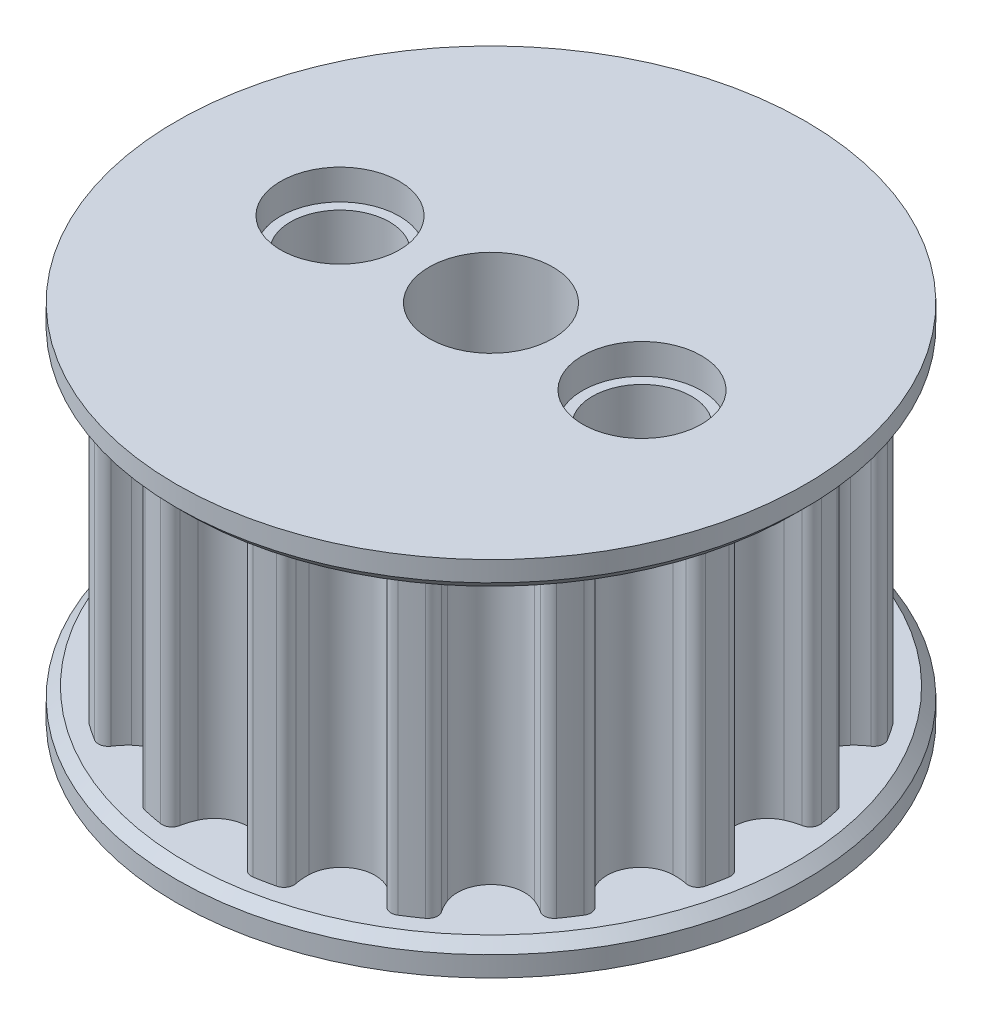
from build123d import *

# Parameters (mm, degrees)
SKETCH1_R           = 1.5625
BOSS_EXTRUDE1_DEPTH = 3.81
SKETCH2_R           = 7.9375
SKETCH2_R_2         = 1.5625
BOSS_EXTRUDE2_DEPTH = 0.762
SKETCH3_R           = 1.5
CUT_EXTRUDE1_DEPTH  = 15.009487375
SKETCH4_R           = 1.25
CUT_EXTRUDE2_DEPTH  = 14.567321493
CHAMFER1_SIZE       = 0.254


with BuildPart() as part:
    # Sketch1 → Boss-Extrude1 (new, symmetric)
    with BuildSketch(Plane(origin=(0, 0, 0), x_dir=(1, 0, 0), z_dir=(0, 1, 0))):
        with BuildLine():
            ThreePointArc((-1.850768, -6.777037356), (-1.816941892, -6.962421006), (-1.663291889, -7.071521784))
            ThreePointArc((-1.663291889, -7.071521784), (-1.417233644, -7.124914669), (-1.169472895, -7.169748489))
            ThreePointArc((-1.169472895, -7.169748489), (-0.985767742, -7.127751824), (-0.883573242, -6.969424355))
            ThreePointArc((-0.883573242, -6.969424355), (-0.839120956, -6.792881518), (-0.773880597, -6.622919538))
            ThreePointArc((-0.773880597, -6.622919538), (0, -6.1245), (0.773880597, -6.622919538))
            ThreePointArc((0.773880597, -6.622919538), (0.839120956, -6.792881518), (0.883573242, -6.969424355))
            ThreePointArc((0.883573242, -6.969424355), (0.985767742, -7.127751824), (1.169472895, -7.169748489))
            ThreePointArc((1.169472895, -7.169748489), (1.417233644, -7.124914669), (1.663291889, -7.071521784))
            ThreePointArc((1.663291889, -7.071521784), (1.816941892, -6.962421006), (1.850768, -6.777037356))
            ThreePointArc((1.850768, -6.777037356), (1.824276538, -6.596921889), (1.819509137, -6.414931089))
            ThreePointArc((1.819509137, -6.414931089), (2.343744682, -5.658300197), (3.249454025, -5.822628523))
            ThreePointArc((3.249454025, -5.822628523), (3.374769892, -5.954686513), (3.483398468, -6.100779674))
            ThreePointArc((3.483398468, -6.100779674), (3.638403174, -6.20794704), (3.824196033, -6.176445981))
            ThreePointArc((3.824196033, -6.176445981), (4.035939958, -6.040210999), (4.242835561, -5.896719991))
            ThreePointArc((4.242835561, -5.896719991), (4.343038594, -5.737124705), (4.303346591, -5.552907854))
            ThreePointArc((4.303346591, -5.552907854), (4.209944466, -5.396640704), (4.135895098, -5.230327534))
            ThreePointArc((4.135895098, -5.230327534), (4.330675481, -4.330675481), (5.230327534, -4.135895098))
            ThreePointArc((5.230327534, -4.135895098), (5.396640704, -4.209944466), (5.552907854, -4.303346591))
            ThreePointArc((5.552907854, -4.303346591), (5.737124705, -4.343038594), (5.896719991, -4.242835561))
            ThreePointArc((5.896719991, -4.242835561), (6.040210999, -4.035939958), (6.176445981, -3.824196033))
            ThreePointArc((6.176445981, -3.824196033), (6.20794704, -3.638403174), (6.100779674, -3.483398468))
            ThreePointArc((6.100779674, -3.483398468), (5.954686513, -3.374769892), (5.822628523, -3.249454025))
            ThreePointArc((5.822628523, -3.249454025), (5.658300197, -2.343744682), (6.414931089, -1.819509137))
            ThreePointArc((6.414931089, -1.819509137), (6.596921889, -1.824276538), (6.777037356, -1.850768))
            ThreePointArc((6.777037356, -1.850768), (6.962421006, -1.816941892), (7.071521784, -1.663291889))
            ThreePointArc((7.071521784, -1.663291889), (7.124914669, -1.417233644), (7.169748489, -1.169472895))
            ThreePointArc((7.169748489, -1.169472895), (7.127751824, -0.985767742), (6.969424355, -0.883573242))
            ThreePointArc((6.969424355, -0.883573242), (6.792881518, -0.839120956), (6.622919538, -0.773880597))
            ThreePointArc((6.622919538, -0.773880597), (6.1245, 0), (6.622919538, 0.773880597))
            ThreePointArc((6.622919538, 0.773880597), (6.792881518, 0.839120956), (6.969424355, 0.883573242))
            ThreePointArc((6.969424355, 0.883573242), (7.127751824, 0.985767742), (7.169748489, 1.169472895))
            ThreePointArc((7.169748489, 1.169472895), (7.124914669, 1.417233644), (7.071521784, 1.663291889))
            ThreePointArc((7.071521784, 1.663291889), (6.962421006, 1.816941892), (6.777037356, 1.850768))
            ThreePointArc((6.777037356, 1.850768), (6.596921889, 1.824276538), (6.414931089, 1.819509137))
            ThreePointArc((6.414931089, 1.819509137), (5.658300197, 2.343744682), (5.822628523, 3.249454025))
            ThreePointArc((5.822628523, 3.249454025), (5.954686513, 3.374769892), (6.100779674, 3.483398468))
            ThreePointArc((6.100779674, 3.483398468), (6.20794704, 3.638403174), (6.176445981, 3.824196033))
            ThreePointArc((6.176445981, 3.824196033), (6.040210999, 4.035939958), (5.896719991, 4.242835561))
            ThreePointArc((5.896719991, 4.242835561), (5.737124705, 4.343038594), (5.552907854, 4.303346591))
            ThreePointArc((5.552907854, 4.303346591), (5.396640704, 4.209944466), (5.230327534, 4.135895098))
            ThreePointArc((5.230327534, 4.135895098), (4.330675481, 4.330675481), (4.135895098, 5.230327534))
            ThreePointArc((4.135895098, 5.230327534), (4.209944466, 5.396640704), (4.303346591, 5.552907854))
            ThreePointArc((4.303346591, 5.552907854), (4.343038594, 5.737124705), (4.242835561, 5.896719991))
            ThreePointArc((4.242835561, 5.896719991), (4.035939958, 6.040210999), (3.824196033, 6.176445981))
            ThreePointArc((3.824196033, 6.176445981), (3.638403174, 6.20794704), (3.483398468, 6.100779674))
            ThreePointArc((3.483398468, 6.100779674), (3.374769892, 5.954686513), (3.249454025, 5.822628523))
            ThreePointArc((3.249454025, 5.822628523), (2.343744682, 5.658300197), (1.819509137, 6.414931089))
            ThreePointArc((1.819509137, 6.414931089), (1.824276538, 6.596921889), (1.850768, 6.777037356))
            ThreePointArc((1.850768, 6.777037356), (1.816941892, 6.962421006), (1.663291889, 7.071521784))
            ThreePointArc((1.663291889, 7.071521784), (1.417233644, 7.124914669), (1.169472895, 7.169748489))
            ThreePointArc((1.169472895, 7.169748489), (0.985767742, 7.127751824), (0.883573242, 6.969424355))
            ThreePointArc((0.883573242, 6.969424355), (0.839120956, 6.792881518), (0.773880597, 6.622919538))
            ThreePointArc((0.773880597, 6.622919538), (0, 6.1245), (-0.773880597, 6.622919538))
            ThreePointArc((-0.773880597, 6.622919538), (-0.839120956, 6.792881518), (-0.883573242, 6.969424355))
            ThreePointArc((-0.883573242, 6.969424355), (-0.985767742, 7.127751824), (-1.169472895, 7.169748489))
            ThreePointArc((-1.169472895, 7.169748489), (-1.417233644, 7.124914669), (-1.663291889, 7.071521784))
            ThreePointArc((-1.663291889, 7.071521784), (-1.816941892, 6.962421006), (-1.850768, 6.777037356))
            ThreePointArc((-1.850768, 6.777037356), (-1.824276538, 6.596921889), (-1.819509137, 6.414931089))
            ThreePointArc((-1.819509137, 6.414931089), (-2.343744682, 5.658300197), (-3.249454025, 5.822628523))
            ThreePointArc((-3.249454025, 5.822628523), (-3.374769892, 5.954686513), (-3.483398468, 6.100779674))
            ThreePointArc((-3.483398468, 6.100779674), (-3.638403174, 6.20794704), (-3.824196033, 6.176445981))
            ThreePointArc((-3.824196033, 6.176445981), (-4.035939958, 6.040210999), (-4.242835561, 5.896719991))
            ThreePointArc((-4.242835561, 5.896719991), (-4.343038594, 5.737124705), (-4.303346591, 5.552907854))
            ThreePointArc((-4.303346591, 5.552907854), (-4.209944466, 5.396640704), (-4.135895098, 5.230327534))
            ThreePointArc((-4.135895098, 5.230327534), (-4.330675481, 4.330675481), (-5.230327534, 4.135895098))
            ThreePointArc((-5.230327534, 4.135895098), (-5.396640704, 4.209944466), (-5.552907854, 4.303346591))
            ThreePointArc((-5.552907854, 4.303346591), (-5.737124705, 4.343038594), (-5.896719991, 4.242835561))
            ThreePointArc((-5.896719991, 4.242835561), (-6.040210999, 4.035939958), (-6.176445981, 3.824196033))
            ThreePointArc((-6.176445981, 3.824196033), (-6.20794704, 3.638403174), (-6.100779674, 3.483398468))
            ThreePointArc((-6.100779674, 3.483398468), (-5.954686513, 3.374769892), (-5.822628523, 3.249454025))
            ThreePointArc((-5.822628523, 3.249454025), (-5.658300197, 2.343744682), (-6.414931089, 1.819509137))
            ThreePointArc((-6.414931089, 1.819509137), (-6.596921889, 1.824276538), (-6.777037356, 1.850768))
            ThreePointArc((-6.777037356, 1.850768), (-6.962421006, 1.816941892), (-7.071521784, 1.663291889))
            ThreePointArc((-7.071521784, 1.663291889), (-7.124914669, 1.417233644), (-7.169748489, 1.169472895))
            ThreePointArc((-7.169748489, 1.169472895), (-7.127751824, 0.985767742), (-6.969424355, 0.883573242))
            ThreePointArc((-6.969424355, 0.883573242), (-6.792881518, 0.839120956), (-6.622919538, 0.773880597))
            ThreePointArc((-6.622919538, 0.773880597), (-6.1245, 0), (-6.622919538, -0.773880597))
            ThreePointArc((-6.622919538, -0.773880597), (-6.792881518, -0.839120956), (-6.969424355, -0.883573242))
            ThreePointArc((-6.969424355, -0.883573242), (-7.127751824, -0.985767742), (-7.169748489, -1.169472895))
            ThreePointArc((-7.169748489, -1.169472895), (-7.124914669, -1.417233644), (-7.071521784, -1.663291889))
            ThreePointArc((-7.071521784, -1.663291889), (-6.962421006, -1.816941892), (-6.777037356, -1.850768))
            ThreePointArc((-6.777037356, -1.850768), (-6.596921889, -1.824276538), (-6.414931089, -1.819509137))
            ThreePointArc((-6.414931089, -1.819509137), (-5.658300197, -2.343744682), (-5.822628523, -3.249454025))
            ThreePointArc((-5.822628523, -3.249454025), (-5.954686513, -3.374769892), (-6.100779674, -3.483398468))
            ThreePointArc((-6.100779674, -3.483398468), (-6.20794704, -3.638403174), (-6.176445981, -3.824196033))
            ThreePointArc((-6.176445981, -3.824196033), (-6.040210999, -4.035939958), (-5.896719991, -4.242835561))
            ThreePointArc((-5.896719991, -4.242835561), (-5.737124705, -4.343038594), (-5.552907854, -4.303346591))
            ThreePointArc((-5.552907854, -4.303346591), (-5.396640704, -4.209944466), (-5.230327534, -4.135895098))
            ThreePointArc((-5.230327534, -4.135895098), (-4.330675481, -4.330675481), (-4.135895098, -5.230327534))
            ThreePointArc((-4.135895098, -5.230327534), (-4.209944466, -5.396640704), (-4.303346591, -5.552907854))
            ThreePointArc((-4.303346591, -5.552907854), (-4.343038594, -5.737124705), (-4.242835561, -5.896719991))
            ThreePointArc((-4.242835561, -5.896719991), (-4.035939958, -6.040210999), (-3.824196033, -6.176445981))
            ThreePointArc((-3.824196033, -6.176445981), (-3.638403174, -6.20794704), (-3.483398468, -6.100779674))
            ThreePointArc((-3.483398468, -6.100779674), (-3.374769892, -5.954686513), (-3.249454025, -5.822628523))
            ThreePointArc((-3.249454025, -5.822628523), (-2.343744682, -5.658300197), (-1.819509137, -6.414931089))
            ThreePointArc((-1.819509137, -6.414931089), (-1.824276538, -6.596921889), (-1.850768, -6.777037356))
        make_face()
        Circle(SKETCH1_R, mode=Mode.SUBTRACT)
    extrude(amount=BOSS_EXTRUDE1_DEPTH, both=True)

    # Sketch4 → Cut-Extrude2 (cut, through all)
    with BuildSketch(Plane.XZ.offset(3.81)):
        with Locations((-3.81, 0)):
            Circle(SKETCH4_R)
        with Locations((3.81, 0)):
            Circle(SKETCH4_R)
    extrude(amount=-CUT_EXTRUDE2_DEPTH, mode=Mode.SUBTRACT)


with BuildPart() as body_2:
    # Sketch2 → Boss-Extrude2 (new body)
    with BuildSketch(Plane.XZ.offset(3.81)):
        Circle(SKETCH2_R)
        Circle(SKETCH2_R_2, mode=Mode.SUBTRACT)
    extrude(amount=BOSS_EXTRUDE2_DEPTH)

    # Sketch3 → Cut-Extrude1 (cut, through all)
    with BuildSketch(Plane.XZ.offset(4.572)):
        with Locations((-3.81, 0)):
            Circle(SKETCH3_R)
        with Locations((3.81, 0)):
            Circle(SKETCH3_R)
    extrude(amount=-CUT_EXTRUDE1_DEPTH, mode=Mode.SUBTRACT)

    # Chamfer1
    chamfer1_edges = [body_2.edges().sort_by_distance(p)[0] for p in [
        (-7.9375, -3.81, 0),
    ]]
    chamfer(chamfer1_edges, length=CHAMFER1_SIZE)


with BuildPart() as body_3:
    # Mirror2: mirrored copy
    add(body_2.part.mirror(Plane.ZX))

    # Combine1: union part, body 2
    add(part.part)
    add(body_2.part)


solid = body_3.part
